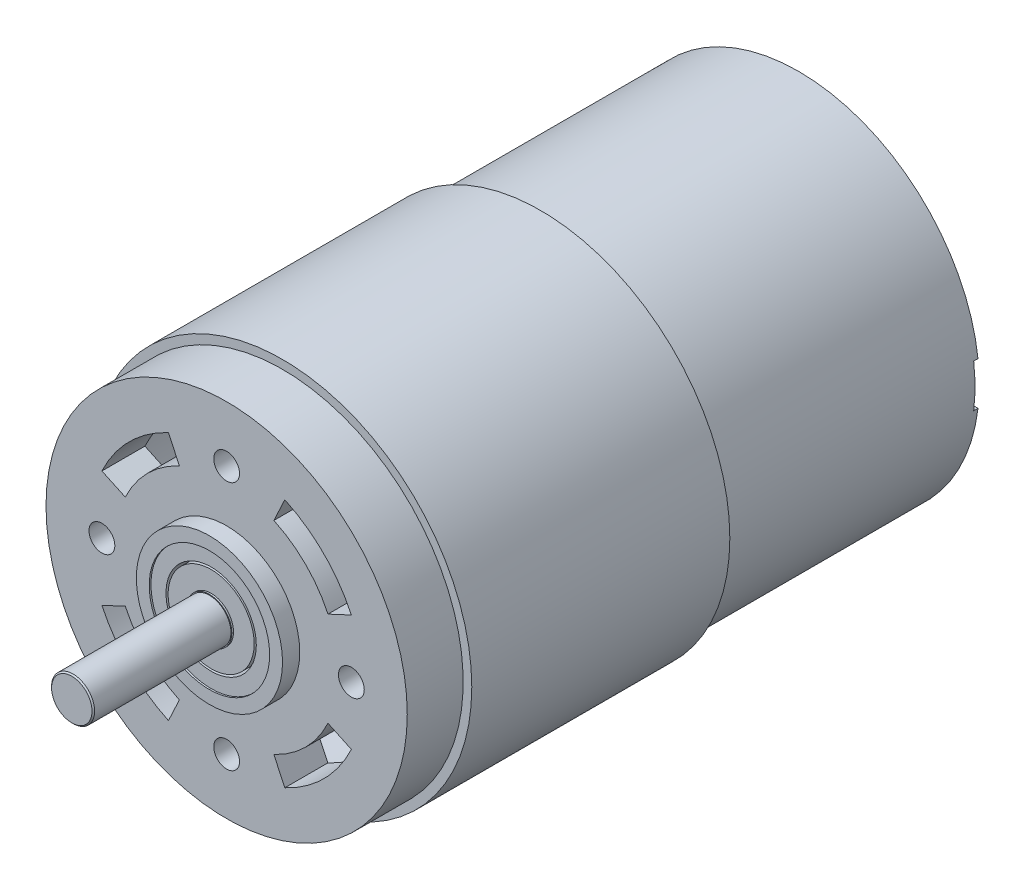
from build123d import *

# Parameters (mm, degrees)
SKETCH1_R           = 21
BOSS_EXTRUDE1_DEPTH = 66.5
SKETCH2_R           = 8.5
BOSS_EXTRUDE2_DEPTH = 2
BOSS_EXTRUDE3_START = 8
SKETCH4_R           = 2.5
BOSS_EXTRUDE3_DEPTH = 92.5
CHAMFER1_SIZE       = 0.15
SKETCH5_R           = 1.5
CUT_EXTRUDE1_DEPTH  = 5
SKETCH7_W           = 3
SKETCH7_H           = 5
CUT_EXTRUDE2_DEPTH  = 0.5
CUT_EXTRUDE3_DEPTH  = 5
BOSS_EXTRUDE4_START = -30
SKETCH9_R           = 22
BOSS_EXTRUDE4_DEPTH = 30
CUT_EXTRUDE5_START  = -2
SKETCH10_R          = 20
SKETCH10_R_2        = 12.5
CUT_EXTRUDE5_DEPTH  = 59.5
SKETCH12_R          = 5
SKETCH12_R_2        = 2.6
BOSS_EXTRUDE5_DEPTH = 4
CHAMFER2_SIZE       = 2
SKETCH14_R          = 20
SKETCH14_R_2        = 14
CUT_EXTRUDE6_DEPTH  = 0.3
SKETCH15_R          = 7
SKETCH15_R_2        = 2.6
CUT_EXTRUDE7_DEPTH  = 0.2
SKETCH16_R          = 5.25
SKETCH16_R_2        = 5
CUT_EXTRUDE8_DEPTH  = 5
SKETCH17_R          = 1.25
CUT_EXTRUDE9_DEPTH  = 0.3
CUT_EXTRUDE12_DEPTH = 1.5
CUT_EXTRUDE13_START = -1
SKETCH20_R          = 20
SKETCH20_R_2        = 2.5
CUT_EXTRUDE13_DEPTH = 1
FILLET1_R           = 2


with BuildPart() as part:
    # Sketch1 → Boss-Extrude1 (new body)
    with BuildSketch(Plane.XY):
        Circle(SKETCH1_R)
    extrude(amount=BOSS_EXTRUDE1_DEPTH)

    # Sketch2 → Boss-Extrude2 (add)
    with BuildSketch(Plane.XY.offset(66.5)):
        Circle(SKETCH2_R)
    extrude(amount=BOSS_EXTRUDE2_DEPTH)

    # Sketch4 → Boss-Extrude3 (add)
    with BuildSketch(Plane(origin=(0, 0, 0), x_dir=(-1, 0, 0), z_dir=(0, 0, -1)).offset(BOSS_EXTRUDE3_START)):
        Circle(SKETCH4_R)
    extrude(amount=-BOSS_EXTRUDE3_DEPTH)

    # Chamfer1
    chamfer1_edges = [part.edges().sort_by_distance(p)[0] for p in [
        (2.5, 0, 84.5),
        (2.5, 0, -8),
    ]]
    chamfer(chamfer1_edges, length=CHAMFER1_SIZE)

    # Sketch5 → Cut-Extrude1 (cut)
    with BuildSketch(Plane.XY.offset(66.5)):
        with Locations((0, 14.5)):
            Circle(SKETCH5_R)
        with Locations((14.5, 0)):
            Circle(SKETCH5_R)
        with Locations((0, -14.5)):
            Circle(SKETCH5_R)
        with Locations((-14.5, 0)):
            Circle(SKETCH5_R)
    extrude(amount=-CUT_EXTRUDE1_DEPTH, mode=Mode.SUBTRACT)

    # Sketch7 → Cut-Extrude2 (cut)
    with BuildSketch(Plane(origin=(0, 0, 0), x_dir=(-1, 0, 0), z_dir=(0, 0, -1))):
        with Locations((19.5, 0)):
            Rectangle(SKETCH7_W, SKETCH7_H)
        with Locations((-19.5, 0)):
            Rectangle(SKETCH7_W, SKETCH7_H)
    extrude(amount=-CUT_EXTRUDE2_DEPTH, mode=Mode.SUBTRACT)

    # Sketch8 → Cut-Extrude3 (cut)
    with BuildSketch(Plane.XY.offset(66.5)):
        with BuildLine():
            Line((6.761892188, 14.500924593), (5.494037403, 11.782001231))
            ThreePointArc((5.494037403, 11.782001231), (9.192388155, 9.192388155), (11.782001231, 5.494037403))
            Line((11.782001231, 5.494037403), (14.500924593, 6.761892188))
            ThreePointArc((14.500924593, 6.761892188), (11.313708499, 11.313708499), (6.761892188, 14.500924593))
        make_face()
        with BuildLine():
            Line((5.494037403, -11.782001231), (6.761892188, -14.500924593))
            ThreePointArc((6.761892188, -14.500924593), (11.313708499, -11.313708499), (14.500924593, -6.761892188))
            Line((14.500924593, -6.761892188), (11.782001231, -5.494037403))
            ThreePointArc((11.782001231, -5.494037403), (9.192388155, -9.192388155), (5.494037403, -11.782001231))
        make_face()
        with BuildLine():
            Line((-11.782001231, -5.494037403), (-14.500924593, -6.761892188))
            ThreePointArc((-14.500924593, -6.761892188), (-11.313708499, -11.313708499), (-6.761892188, -14.500924593))
            Line((-6.761892188, -14.500924593), (-5.494037403, -11.782001231))
            ThreePointArc((-5.494037403, -11.782001231), (-9.192388155, -9.192388155), (-11.782001231, -5.494037403))
        make_face()
        with BuildLine():
            Line((-5.494037403, 11.782001231), (-6.761892188, 14.500924593))
            ThreePointArc((-6.761892188, 14.500924593), (-11.313708499, 11.313708499), (-14.500924593, 6.761892188))
            Line((-14.500924593, 6.761892188), (-11.782001231, 5.494037403))
            ThreePointArc((-11.782001231, 5.494037403), (-9.192388155, 9.192388155), (-5.494037403, 11.782001231))
        make_face()
    extrude(amount=-CUT_EXTRUDE3_DEPTH, mode=Mode.SUBTRACT)

    # Sketch9 → Boss-Extrude4 (add)
    with BuildSketch(Plane(origin=(0, 0, 0), x_dir=(-1, 0, 0), z_dir=(0, 0, -1)).offset(BOSS_EXTRUDE4_START)):
        Circle(SKETCH9_R)
    extrude(amount=-BOSS_EXTRUDE4_DEPTH)

    # Sketch10 → Cut-Extrude5 (cut)
    with BuildSketch(Plane(origin=(0, 0, 0), x_dir=(-1, 0, 0), z_dir=(0, 0, -1)).offset(CUT_EXTRUDE5_START)):
        Circle(SKETCH10_R)
        Circle(SKETCH10_R_2, mode=Mode.SUBTRACT)
    extrude(amount=-CUT_EXTRUDE5_DEPTH, mode=Mode.SUBTRACT)

    # Sketch12 → Boss-Extrude5 (add)
    with BuildSketch(Plane(origin=(0, 0, 0), x_dir=(-1, 0, 0), z_dir=(0, 0, -1))):
        with Locations(Location((0, 0, 0), (0, 0, 180))):
            Circle(SKETCH12_R)
        Circle(SKETCH12_R_2, mode=Mode.SUBTRACT)
    extrude(amount=BOSS_EXTRUDE5_DEPTH)

    # Chamfer2
    chamfer2_edges = [part.edges().sort_by_distance(p)[0] for p in [
        (-5, 0, -4),
    ]]
    chamfer(chamfer2_edges, length=CHAMFER2_SIZE)

    # Sketch14 → Cut-Extrude6 (cut)
    with BuildSketch(Plane(origin=(0, 0, 0), x_dir=(-1, 0, 0), z_dir=(0, 0, -1))):
        Circle(SKETCH14_R)
        Circle(SKETCH14_R_2, mode=Mode.SUBTRACT)
    extrude(amount=-CUT_EXTRUDE6_DEPTH, mode=Mode.SUBTRACT)

    # Sketch15 → Cut-Extrude7 (cut)
    with BuildSketch(Plane.XY.offset(68.5)):
        Circle(SKETCH15_R)
        with Locations(Location((0, 0, 0), (0, 0, 180))):
            Circle(SKETCH15_R_2, mode=Mode.SUBTRACT)
    extrude(amount=-CUT_EXTRUDE7_DEPTH, mode=Mode.SUBTRACT)

    # Sketch16 → Cut-Extrude8 (cut)
    with BuildSketch(Plane.XY.offset(68.3)):
        Circle(SKETCH16_R)
        Circle(SKETCH16_R_2, mode=Mode.SUBTRACT)
    extrude(amount=-CUT_EXTRUDE8_DEPTH, mode=Mode.SUBTRACT)

    # Sketch17 → Cut-Extrude9 (cut)
    with BuildSketch(Plane(origin=(0, 0, 0.3), x_dir=(-1, 0, 0), z_dir=(0, 0, -1))):
        with Locations((13.826532207, 9.893378466)):
            Circle(SKETCH17_R)
        with Locations(Location((9.893378466, 13.826532207, 0), (0, 0, 180))):
            Circle(SKETCH17_R)
        with Locations(Location((13.826532207, -9.893378466, 0), (0, 0, 180))):
            Circle(SKETCH17_R)
        with Locations((9.893378466, -13.826532207)):
            Circle(SKETCH17_R)
        with Locations(Location((-9.893378466, -13.826532207, 0), (0, 0, 180))):
            Circle(SKETCH17_R)
        with Locations((-13.826532207, -9.893378466)):
            Circle(SKETCH17_R)
        with Locations(Location((-13.826532207, 9.893378466, 0), (0, 0, 180))):
            Circle(SKETCH17_R)
        with Locations((-9.893378466, 13.826532207)):
            Circle(SKETCH17_R)
    extrude(amount=-CUT_EXTRUDE9_DEPTH, mode=Mode.SUBTRACT)

    # Sketch19 → Cut-Extrude12 (cut)
    with BuildSketch(Plane(origin=(0, 0, 0), x_dir=(-1, 0, 0), z_dir=(0, 0, -1))):
        with BuildLine():
            ThreePointArc((-7.987387277, -2.907171218), (-6.01040764, -6.01040764), (-2.907171218, -7.987387277))
            Line((-2.907171218, -7.987387277), (-4.275251792, -11.74615776))
            ThreePointArc((-4.275251792, -11.74615776), (-8.838834765, -8.838834765), (-11.74615776, -4.275251792))
            Line((-11.74615776, -4.275251792), (-7.987387277, -2.907171218))
        make_face()
        with BuildLine():
            ThreePointArc((7.987387277, 2.907171218), (6.01040764, 6.01040764), (2.907171218, 7.987387277))
            Line((2.907171218, 7.987387277), (4.275251792, 11.74615776))
            ThreePointArc((4.275251792, 11.74615776), (8.838834765, 8.838834765), (11.74615776, 4.275251792))
            Line((11.74615776, 4.275251792), (7.987387277, 2.907171218))
        make_face()
        with BuildLine():
            ThreePointArc((2.907171218, -7.987387277), (6.01040764, -6.01040764), (7.987387277, -2.907171218))
            Line((7.987387277, -2.907171218), (11.74615776, -4.275251792))
            ThreePointArc((11.74615776, -4.275251792), (8.838834765, -8.838834765), (4.275251792, -11.74615776))
            Line((4.275251792, -11.74615776), (2.907171218, -7.987387277))
        make_face()
        with BuildLine():
            ThreePointArc((-2.907171218, 7.987387277), (-6.01040764, 6.01040764), (-7.987387277, 2.907171218))
            Line((-7.987387277, 2.907171218), (-11.74615776, 4.275251792))
            ThreePointArc((-11.74615776, 4.275251792), (-8.838834765, 8.838834765), (-4.275251792, 11.74615776))
            Line((-4.275251792, 11.74615776), (-2.907171218, 7.987387277))
        make_face()
    extrude(amount=-CUT_EXTRUDE12_DEPTH, mode=Mode.SUBTRACT)

    # Sketch20 → Cut-Extrude13 (cut)
    with BuildSketch(Plane(origin=(0, 0, 0), x_dir=(-1, 0, 0), z_dir=(0, 0, -1)).offset(CUT_EXTRUDE13_START)):
        Circle(SKETCH20_R)
        Circle(SKETCH20_R_2, mode=Mode.SUBTRACT)
    extrude(amount=-CUT_EXTRUDE13_DEPTH, mode=Mode.SUBTRACT)

    # Fillet1
    fillet1_edges = [part.edges().sort_by_distance(p)[0] for p in [
        (2.907171218, -7.987387277, 0.5),
        (4.275251792, -11.74615776, 0.5),
        (-4.275251792, -11.74615776, 0.5),
        (-11.74615776, -4.275251792, 0.5),
        (-2.907171218, -7.987387277, 0.5),
        (11.74615776, -4.275251792, 0.5),
        (7.987387277, -2.907171218, 0.5),
        (-7.987387277, -2.907171218, 0.5),
        (-11.74615776, 4.275251792, 0.5),
        (-7.987387277, 2.907171218, 0.5),
        (7.987387277, 2.907171218, 0.5),
        (2.907171218, 7.987387277, 0.5),
        (4.275251792, 11.74615776, 0.5),
        (11.74615776, 4.275251792, 0.5),
        (-2.907171218, 7.987387277, 0.5),
        (-4.275251792, 11.74615776, 0.5),
    ]]
    fillet(fillet1_edges, radius=FILLET1_R - 0.0001)  # a hair under: the kernel refuses the full size


solid = part.part
